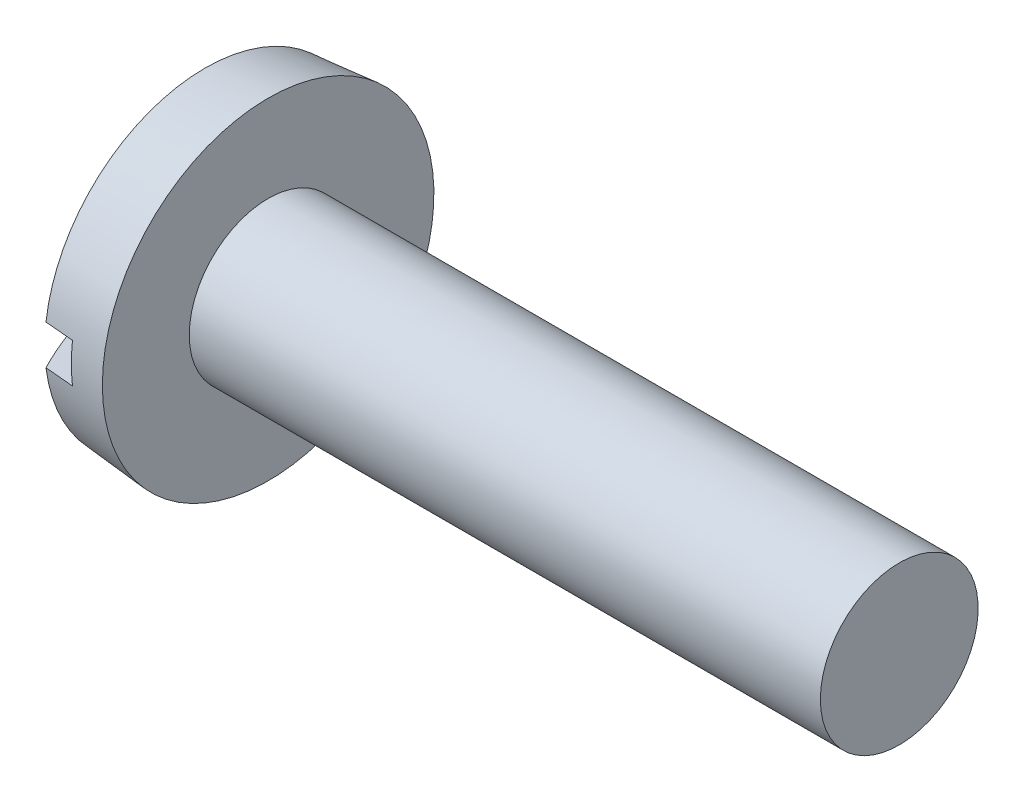
from build123d import *

# Parameters (mm, degrees)
SKETCH2_W         = 20.0152
SKETCH2_H         = 2.3876
SLOT_DEPTH        = 4.1402
CIRPATTERN1_COUNT = 2
CIRPATTERN1_ANGLE = 90


with BuildPart() as part:
    # BodySke → Base-Revolve (revolve)
    with BuildSketch(Plane.XY):
        with BuildLine():
            Line((6.1976, 4.7625), (6.1976, 10.0076))
            Line((6.1976, 10.0076), (2.3876, 9.674268192))
            ThreePointArc((2.3876, 9.674268192), (0.605722555, 4.982271039), (0, 0))
            Line((0, 0), (44.2976, 0))
            Line((44.2976, 0), (44.2976, 4.7625))
            Line((44.2976, 4.7625), (6.1976, 4.7625))
        make_face()
    revolve(axis=Axis((-25.4, 0, 0), (1, 0, 0)))

    # Sketch2 → Slot (cut)
    with BuildSketch(Plane(origin=(0, 0, 0), x_dir=(0, 0, -1), z_dir=(1, 0, 0))):
        Rectangle(SKETCH2_W, SKETCH2_H)
    extrude(amount=SLOT_DEPTH, mode=Mode.SUBTRACT)

    # Sketch3 → Cross section 0
    with BuildSketch(Plane(origin=(0, 0, 0), x_dir=(0, 0, -1), z_dir=(1, 0, 0))):
        with BuildLine():
            Line((-1.0287, 6.096), (1.0287, 6.096))
            Line((1.0287, 6.096), (1.0287, -6.096))
            Line((1.0287, -6.096), (-1.0287, -6.096))
            Line((-1.0287, -6.096), (-1.0287, 6.096))
        make_face()
    # Sketch4 → Cross section 1
    with BuildSketch(Plane(origin=(7.2644, 0, 0), x_dir=(0, 0, -1), z_dir=(1, 0, 0))):
        with BuildLine():
            Line((-0.51435, 0.51435), (0.51435, 0.51435))
            Line((0.51435, 0.51435), (0.51435, -0.51435))
            Line((0.51435, -0.51435), (-0.51435, -0.51435))
            Line((-0.51435, -0.51435), (-0.51435, 0.51435))
        make_face()
    cross = loft(mode=Mode.SUBTRACT)

    # CirPattern1: Cross ×2 about axis
    cirpattern1_axis = Axis((-25.4, 0, 0), (1, 0, 0))
    for i in range(1, CIRPATTERN1_COUNT):
        add(cross.rotate(cirpattern1_axis, i * CIRPATTERN1_ANGLE / (CIRPATTERN1_COUNT - 1)), mode=Mode.SUBTRACT)


solid = part.part
